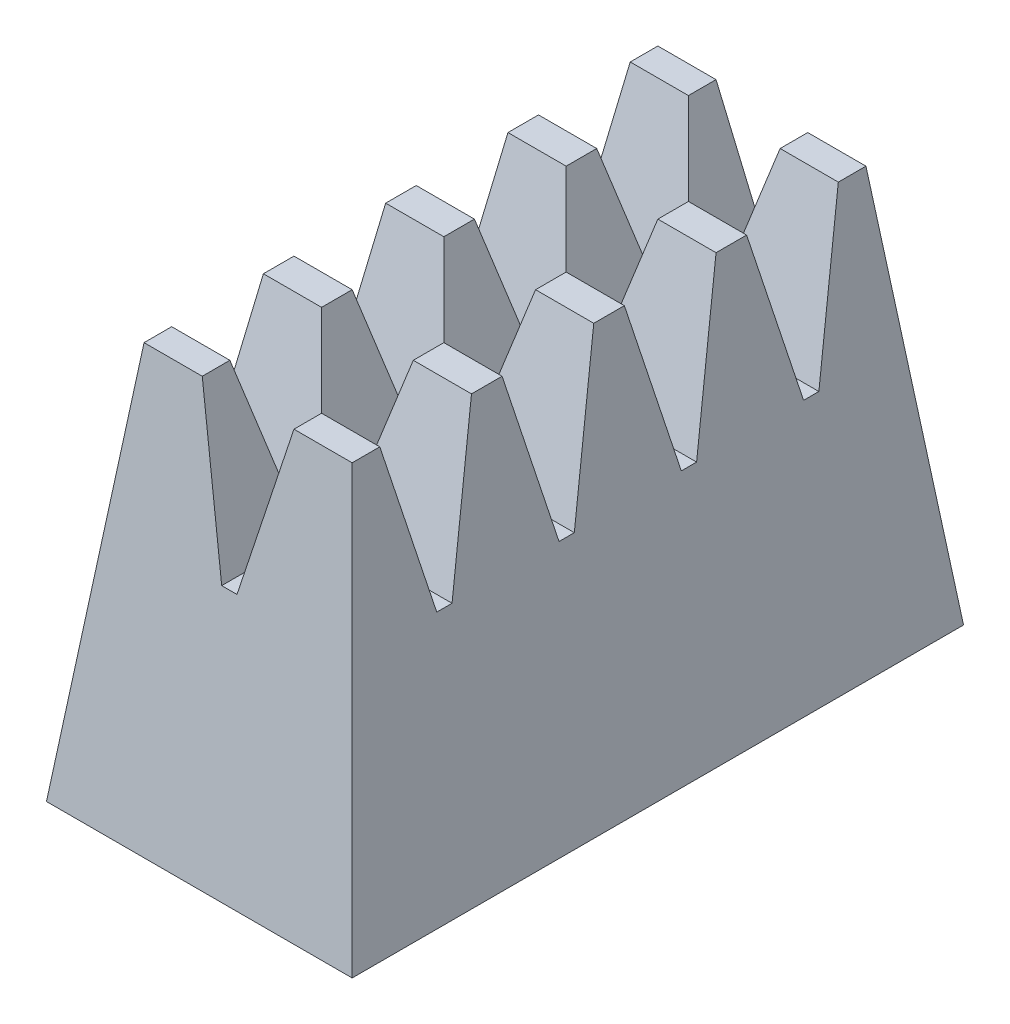
from build123d import *

# Parameters (mm, degrees)
RESSALTO_EXTRUS_O1_DEPTH   = 20
INCLINA_O1_DEPTH           = 20
INCLINA_O1_START           = -6
INCLINA_O1_2_DEPTH         = 12
CORTE_EXTRUS_O1_DEPTH      = 25.372115214
CORTE_EXTRUS_O1_DEPTH_BACK = 25.372115214
M5_GEWINDEBOHRUNG1_D       = 4.2
M5_GEWINDEBOHRUNG1_DEPTH   = 5
M5_GEWINDEBOHRUNG1_TIP     = 1.2618073


with BuildPart() as part:
    # Esboço1 → Ressalto-extrusão1 (new body)
    with BuildSketch(Plane.XY):
        Polygon((-5, 0), (5, 0), (3.5, 13), (1.5, 13), (0.25, 8), (-0.25, 8), (-1.5, 13), (-3.5, 13), align=None)
    extrude(amount=RESSALTO_EXTRUS_O1_DEPTH)

    # Inclinação1: read off the stored shape, not the designer's step
    # Inclinação1 outline → Inclinação1 (cut)
    with BuildSketch(Plane.XY):
        Polygon((3.5, 13), (3.403800708, 13), (5, 0), align=None)
        Polygon((-5, 0), (-3.403800708, 13), (-3.5, 13), align=None)
    extrude(amount=INCLINA_O1_DEPTH, mode=Mode.SUBTRACT)

    # Inclina_o1 2 outline → Inclina_o1 2 (cut)
    with BuildSketch(Plane.YZ.offset(INCLINA_O1_START)):
        Polygon((13, 18.403800708), (13, 20), (0, 20), align=None)
        Polygon((13, 0), (13, 1.596199292), (0, 0), align=None)
    extrude(amount=INCLINA_O1_2_DEPTH, mode=Mode.SUBTRACT)

    # Esboço3 → Corte-extrusão1 (cut, two sides: drawn at the far end of the back side and taken through both)
    with BuildSketch(Plane(origin=(0, 0, 0), x_dir=(0, 0, -1), z_dir=(1, 0, 0)).offset(-CORTE_EXTRUS_O1_DEPTH_BACK)):
        Polygon((-17.5, 13), (-16.25, 8), (-15.75, 8), (-14.5, 13), align=None)
        Polygon((-13.5, 13), (-12.25, 8), (-11.75, 8), (-10.5, 13), align=None)
        Polygon((-9.5, 13), (-8.25, 8), (-7.75, 8), (-6.5, 13), align=None)
        Polygon((-5.5, 13), (-4.25, 8), (-3.75, 8), (-2.5, 13), align=None)
    extrude(amount=CORTE_EXTRUS_O1_DEPTH + CORTE_EXTRUS_O1_DEPTH_BACK, mode=Mode.SUBTRACT)

    # M5 Gewindebohrung1
    with Locations(Plane(origin=(0, 0, 10), x_dir=(-1, 0, 0), z_dir=(0, -1, 0))):
        with Locations((0, 0)):
            Hole(M5_GEWINDEBOHRUNG1_D / 2, depth=M5_GEWINDEBOHRUNG1_DEPTH)
            with Locations((0, 0, -(M5_GEWINDEBOHRUNG1_DEPTH + M5_GEWINDEBOHRUNG1_TIP / 2))):  # 118° drill point
                Cone(0, M5_GEWINDEBOHRUNG1_D / 2, M5_GEWINDEBOHRUNG1_TIP, mode=Mode.SUBTRACT)


solid = part.part
